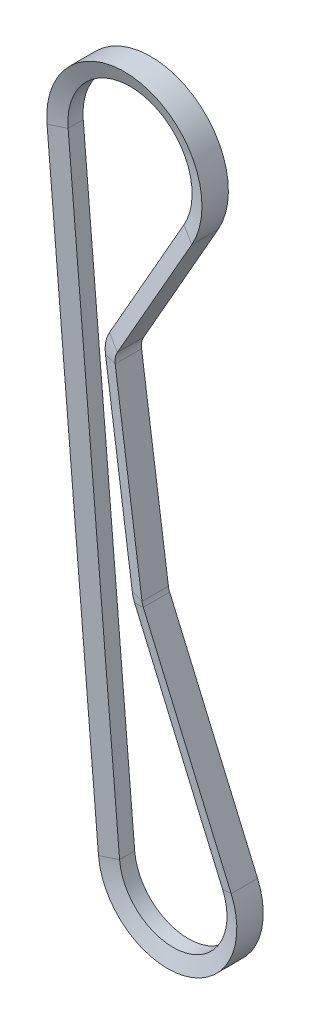
from build123d import *


with BuildPart() as part:
    # Sweep1: sweep along a path in Sketch2
    with BuildLine(Plane.XY) as sweep1_path:
        Line((-24.910797924, -2.110011085), (-43.47716902, 217.084628139))
        ThreePointArc((-43.47716902, 217.084628139), (-9.550723602, 246.791634816), (8.744795544, 205.57532829))
        Line((8.744795544, 205.57532829), (-18.11543606, 158.482842613))
        ThreePointArc((-18.11543606, 158.482842613), (-18.835529544, 156.534867344), (-18.888587904, 154.458734621))
        Line((-18.888587904, 154.458734621), (-9.209622988, 85.131123685))
        ThreePointArc((-9.209622988, 85.131123685), (-9.035860675, 84.29849786), (-8.752379773, 83.496564143))
        Line((-8.752379773, 83.496564143), (22.959690911, 9.89204697))
        ThreePointArc((22.959690911, 9.89204697), (6.079807072, -24.249452488), (-24.910797924, -2.110011085))
    # Sketch3 → Sweep1 (sweep)
    with BuildSketch(Plane(origin=(22.959690911, 9.89204697, 0), x_dir=(-0.91838763645459, -0.3956818787957721, 0), z_dir=(0.3956818787957721, -0.91838763645459, 0))):
        Polygon((0, -4.7625), (0, 4.7625), (5.588, 2.728634331), (5.588, -2.728634331), align=None)
    sweep(path=sweep1_path.line)


solid = part.part
